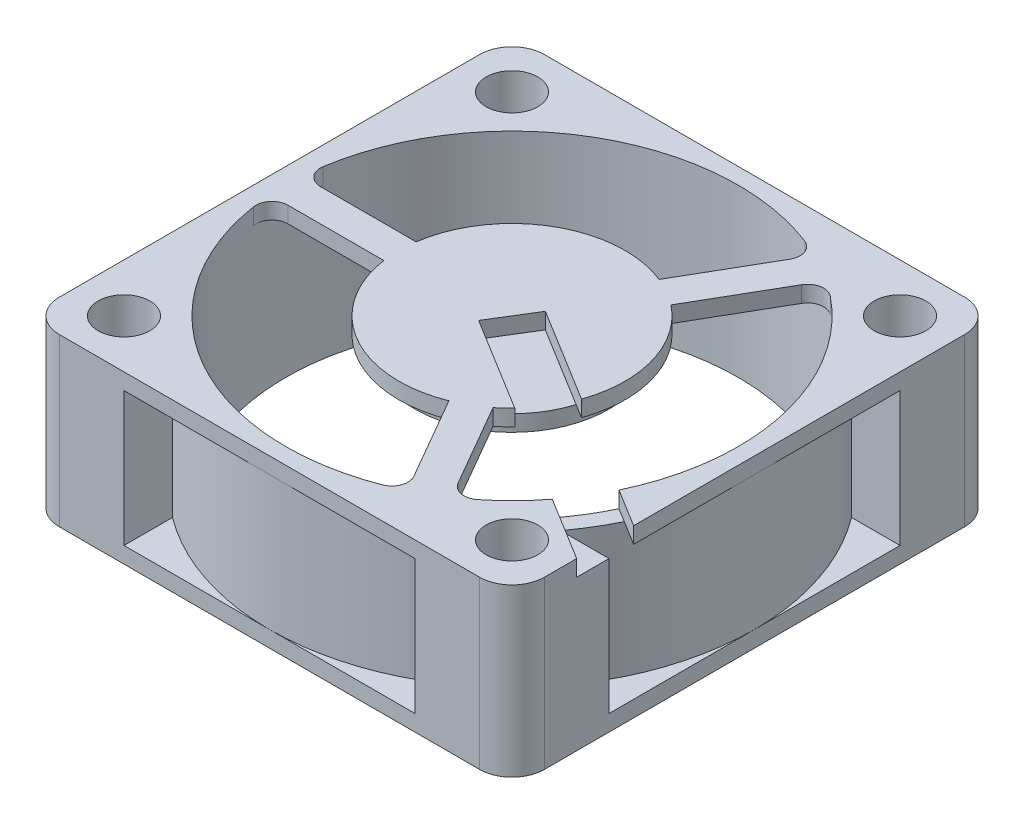
from build123d import *
from build123d.topology import SkipClean

# Parameters (mm, degrees)
CROQUIS2_R               = 1.6
CROQUIS2_R_2             = 14
SALIENTE_EXTRUIR1_DEPTH  = 1
SALIENTE_EXTRUIR2_START  = -10.3
CROQUIS3_R               = 15
CROQUIS3_R_2             = 14
SALIENTE_EXTRUIR2_DEPTH  = 10.3
SALIENTE_EXTRUIR4_START  = -1
SALIENTE_EXTRUIR4_DEPTH  = 1
REDONDEO2_R              = 1
REDONDEO3_R              = 2
CROQUIS11_R              = 1.6
SALIENTE_EXTRUIR9_DEPTH  = 1
SALIENTE_EXTRUIR10_START = 8.3
CROQUIS12_R              = 1.6
SALIENTE_EXTRUIR10_DEPTH = 8.3
CROQUIS13_R              = 6
SALIENTE_EXTRUIR11_DEPTH = 1
CORTAR_EXTRUIR1_DEPTH    = 1


with BuildPart() as part:
    # Croquis2 → Saliente-Extruir1 (new body)
    with BuildSketch(Plane(origin=(0, 0, 0), x_dir=(1, 0, 0), z_dir=(0, 1, 0))):
        Polygon((-15, 15), (-15, -15), (15, -15), (15, 9.614285714), (15, 15), align=None)
        with BuildLine():
            ThreePointArc((-14, -13.979950525), (-13.990000513, -13.990000513), (-13.979950525, -14))
            Line((-13.979950525, -14), (-14, -14))
            Line((-14, -14), (-14, -13.979950525))
        make_face(mode=Mode.SUBTRACT)
        with Locations(Location((-12, -12, 0), (0, 0, 270))):
            Circle(CROQUIS2_R, mode=Mode.SUBTRACT)
        with BuildLine():
            Line((14, -14), (13.979950525, -14))
            ThreePointArc((13.979950525, -14), (13.990000513, -13.990000513), (14, -13.979950525))
            Line((14, -13.979950525), (14, -14))
        make_face(mode=Mode.SUBTRACT)
        with Locations(Location((12, -12, 0), (0, 0, 270))):
            Circle(CROQUIS2_R, mode=Mode.SUBTRACT)
        with Locations(Location((-12, 12, 0), (0, 0, 270))):
            Circle(CROQUIS2_R, mode=Mode.SUBTRACT)
        with BuildLine():
            ThreePointArc((-13.979950525, 14), (-13.990000513, 13.990000513), (-14, 13.979950525))
            Line((-14, 13.979950525), (-14, 14))
            Line((-14, 14), (-13.979950525, 14))
        make_face(mode=Mode.SUBTRACT)
        with Locations(Location((0, 0, 0), (0, 0, 270))):
            Circle(CROQUIS2_R_2, mode=Mode.SUBTRACT)
        with Locations(Location((12, 12, 0), (0, 0, 270))):
            Circle(CROQUIS2_R, mode=Mode.SUBTRACT)
    extrude(amount=SALIENTE_EXTRUIR1_DEPTH)

    # Croquis3 → Saliente-Extruir2 (add)
    with BuildSketch(Plane(origin=(0, 1, 0), x_dir=(1, 0, 0), z_dir=(0, 1, 0)).offset(SALIENTE_EXTRUIR2_START)):
        with Locations(Location((0, 0, 0), (0, 0, 270))):
            Circle(CROQUIS3_R)
        with Locations(Location((0, 0, 0), (0, 0, 270))):
            Circle(CROQUIS3_R_2, mode=Mode.SUBTRACT)
    extrude(amount=SALIENTE_EXTRUIR2_DEPTH)

    # Croquis5 → Saliente-Extruir4 (add)
    with BuildSketch(Plane(origin=(0, 1, 0), x_dir=(1, 0, 0), z_dir=(0, 1, 0)).offset(SALIENTE_EXTRUIR4_START)):
        with BuildLine():
            ThreePointArc((-13.964240044, 1), (-14, 0), (-13.964240044, -1))
            Line((-13.964240044, -1), (-6.92820323, -1))
            ThreePointArc((-6.92820323, -1), (-7, 0), (-6.92820323, 1))
            Line((-6.92820323, 1), (-13.964240044, 1))
        make_face()
        with BuildLine():
            ThreePointArc((-6.92820323, 1), (-7, 0), (-6.92820323, -1))
            Line((-6.92820323, -1), (-1.732050808, -1))
            Line((-1.732050808, -1), (-1.154700538, 0))
            Line((-1.154700538, 0), (-1.732050808, 1))
            Line((-1.732050808, 1), (-6.92820323, 1))
        make_face()
        with BuildLine():
            ThreePointArc((-4.330127019, 5.5), (-6.062177826, 3.5), (-6.92820323, 1))
            Line((-6.92820323, 1), (-1.732050808, 1))
            Line((-1.732050808, 1), (-4.330127019, 5.5))
        make_face()
        with BuildLine():
            Line((-4.330127019, 5.5), (-1.732050808, 1))
            Line((-1.732050808, 1), (-0.577350269, 1))
            Line((-0.577350269, 1), (0, 2))
            Line((0, 2), (-2.598076211, 6.5))
            ThreePointArc((-2.598076211, 6.5), (-3.5, 6.062177826), (-4.330127019, 5.5))
        make_face()
        with BuildLine():
            ThreePointArc((2.598076211, 6.5), (0, 7), (-2.598076211, 6.5))
            Line((-2.598076211, 6.5), (0, 2))
            Line((0, 2), (2.598076211, 6.5))
        make_face()
        with BuildLine():
            Line((4.330127019, 5.5), (1.732050808, 1))
            Line((1.732050808, 1), (6.92820323, 1))
            ThreePointArc((6.92820323, 1), (6.062177826, 3.5), (4.330127019, 5.5))
        make_face()
        with BuildLine():
            Line((0, 2), (0.577350269, 1))
            Line((0.577350269, 1), (1.732050808, 1))
            Line((1.732050808, 1), (4.330127019, 5.5))
            ThreePointArc((4.330127019, 5.5), (3.5, 6.062177826), (2.598076211, 6.5))
            Line((2.598076211, 6.5), (0, 2))
        make_face()
        with BuildLine():
            Line((1.154700538, 0), (1.732050808, -1))
            Line((1.732050808, -1), (6.92820323, -1))
            ThreePointArc((6.92820323, -1), (6.982027736, -0.501287038), (7, 0))
            ThreePointArc((7, 0), (6.982027736, 0.501287038), (6.92820323, 1))
            Line((6.92820323, 1), (1.732050808, 1))
            Line((1.732050808, 1), (1.154700538, 0))
        make_face()
        with BuildLine():
            Line((6.92820323, -1), (1.732050808, -1))
            Line((1.732050808, -1), (4.330127019, -5.5))
            ThreePointArc((4.330127019, -5.5), (6.062177826, -3.5), (6.92820323, -1))
        make_face()
        with BuildLine():
            Line((1.732050808, -1), (0.577350269, -1))
            Line((0.577350269, -1), (0, -2))
            Line((0, -2), (2.598076211, -6.5))
            ThreePointArc((2.598076211, -6.5), (3.5, -6.062177826), (4.330127019, -5.5))
            Line((4.330127019, -5.5), (1.732050808, -1))
        make_face()
        with BuildLine():
            Line((0, -2), (-2.598076211, -6.5))
            ThreePointArc((-2.598076211, -6.5), (0, -7), (2.598076211, -6.5))
            Line((2.598076211, -6.5), (0, -2))
        make_face()
        with BuildLine():
            Line((-0.577350269, -1), (-1.732050808, -1))
            Line((-1.732050808, -1), (-4.330127019, -5.5))
            ThreePointArc((-4.330127019, -5.5), (-3.5, -6.062177826), (-2.598076211, -6.5))
            Line((-2.598076211, -6.5), (0, -2))
            Line((0, -2), (-0.577350269, -1))
        make_face()
        with BuildLine():
            Line((-1.732050808, -1), (-6.92820323, -1))
            ThreePointArc((-6.92820323, -1), (-6.062177826, -3.5), (-4.330127019, -5.5))
            Line((-4.330127019, -5.5), (-1.732050808, -1))
        make_face()
        Polygon((-1.154700538, 0), (-0.577350269, -1), (0.577350269, -1), (1.154700538, 0), (0.577350269, 1), (-0.577350269, 1), align=None)
        Polygon((-1.732050808, 1), (-1.154700538, 0), (-0.577350269, 1), align=None)
        Polygon((-1.154700538, 0), (-1.732050808, -1), (-0.577350269, -1), align=None)
        Polygon((0.577350269, -1), (-0.577350269, -1), (0, -2), align=None)
        Polygon((1.154700538, 0), (0.577350269, -1), (1.732050808, -1), align=None)
        Polygon((0.577350269, 1), (1.154700538, 0), (1.732050808, 1), align=None)
        Polygon((0, 2), (-0.577350269, 1), (0.577350269, 1), align=None)
        with BuildLine():
            ThreePointArc((7.848145426, 11.593386622), (7, 12.124355653), (6.116094618, 12.593386622))
            Line((6.116094618, 12.593386622), (2.598076211, 6.5))
            ThreePointArc((2.598076211, 6.5), (3.5, 6.062177826), (4.330127019, 5.5))
            Line((4.330127019, 5.5), (7.848145426, 11.593386622))
        make_face()
        with BuildLine():
            Line((2.598076211, -6.5), (6.116094618, -12.593386622))
            ThreePointArc((6.116094618, -12.593386622), (7, -12.124355653), (7.848145426, -11.593386622))
            Line((7.848145426, -11.593386622), (4.330127019, -5.5))
            ThreePointArc((4.330127019, -5.5), (3.5, -6.062177826), (2.598076211, -6.5))
        make_face()
    extrude(amount=SALIENTE_EXTRUIR4_DEPTH)

    # Redondeo2
    redondeo2_edges = [part.edges().sort_by_distance(p)[0] for p in [
        (-13.964240044, 0.5, 1),
        (-13.964240044, 0.5, -1),
        (6.116094618, 0.5, -12.593386622),
        (7.848145426, 0.5, -11.593386622),
        (7.848145426, 0.5, 11.593386622),
        (6.116094618, 0.5, 12.593386622),
    ]]
    fillet(redondeo2_edges, radius=REDONDEO2_R)

    # Redondeo3
    redondeo3_edges = [part.edges().sort_by_distance(p)[0] for p in [
        (-15, 0.5, 15),
        (-15, 0.5, -15),
        (15, 0.5, -15),
        (15, 0.5, 15),
    ]]
    fillet(redondeo3_edges, radius=REDONDEO3_R)

    # Croquis11 → Saliente-Extruir9 (add)
    # profile 1 of 4: a face of its own
    with BuildSketch(Plane.XZ.offset(9.3)):
        with BuildLine():
            ThreePointArc((-15, 0), (-10.606601718, 10.606601718), (0, 15))
            Line((0, 15), (-13, 15))
            ThreePointArc((-13, 15), (-14.414213562, 14.414213562), (-15, 13))
            Line((-15, 13), (-15, 0))
        make_face()
        with Locations(Location((-12, 12, 0), (0, 0, 90))):
            Circle(CROQUIS11_R, mode=Mode.SUBTRACT)
    # profile 2 of 4: a face of its own
    with BuildSketch(Plane.XZ.offset(9.3)):
        with BuildLine():
            ThreePointArc((0, 15), (10.606601718, 10.606601718), (15, 0))
            Line((15, 0), (15, 13))
            ThreePointArc((15, 13), (14.414213562, 14.414213562), (13, 15))
            Line((13, 15), (0, 15))
        make_face()
        with Locations(Location((12, 12, 0), (0, 0, 90))):
            Circle(CROQUIS11_R, mode=Mode.SUBTRACT)
    # profile 3 of 4: a face of its own
    with BuildSketch(Plane.XZ.offset(9.3)):
        with BuildLine():
            Line((15, -13), (15, 0))
            ThreePointArc((15, 0), (10.606601718, -10.606601718), (0, -15))
            Line((0, -15), (13, -15))
            ThreePointArc((13, -15), (14.414213562, -14.414213562), (15, -13))
        make_face()
        with Locations(Location((12, -12, 0), (0, 0, 90))):
            Circle(CROQUIS11_R, mode=Mode.SUBTRACT)
    # profile 4 of 4: a face of its own
    with BuildSketch(Plane.XZ.offset(9.3)):
        with BuildLine():
            Line((-13, -15), (0, -15))
            ThreePointArc((0, -15), (-10.606601718, -10.606601718), (-15, 0))
            Line((-15, 0), (-15, -13))
            ThreePointArc((-15, -13), (-14.414213562, -14.414213562), (-13, -15))
        make_face()
        with Locations(Location((-12, -12, 0), (0, 0, 90))):
            Circle(CROQUIS11_R, mode=Mode.SUBTRACT)
    extrude(amount=-SALIENTE_EXTRUIR9_DEPTH)

    # Croquis12 → Saliente-Extruir10 (add)
    # profile 1 of 25: a face of its own
    with SkipClean():  # the faces are left unmerged after this step: merging them gives an invalid solid
        with BuildSketch(Plane.XZ.offset(SALIENTE_EXTRUIR10_START)):
            with BuildLine():
                ThreePointArc((-9, -12), (-9.878679656, -14.121320344), (-12, -15))
                Line((-12, -15), (-9, -15))
                Line((-9, -15), (-9, -12))
            make_face()
        # profile 2 of 25: a face of its own
        with BuildSketch(Plane.XZ.offset(SALIENTE_EXTRUIR10_START)):
            with BuildLine():
                ThreePointArc((-10.165059333, -9.626607334), (-11.030509928, -9.160970412), (-12, -9))
                ThreePointArc((-12, -9), (-10.606601718, -10.606601718), (-9, -12))
                ThreePointArc((-9, -12), (-9.160970412, -11.030509928), (-9.626607334, -10.165059333))
                ThreePointArc((-9.626607334, -10.165059333), (-9.899494937, -9.899494937), (-10.165059333, -9.626607334))
            make_face()
        # profile 3 of 25: a face of its own
        with BuildSketch(Plane.XZ.offset(SALIENTE_EXTRUIR10_START)):
            with BuildLine():
                Line((9, -15), (11.999999991, -15))
                ThreePointArc((11.999999991, -15), (9.878679653, -14.12132034), (9, -12))
                Line((9, -12), (9, -15))
            make_face()
        # profile 4 of 25: a face of its own
        with BuildSketch(Plane.XZ.offset(SALIENTE_EXTRUIR10_START)):
            with BuildLine():
                Line((15, -13), (15, -12))
                ThreePointArc((15, -12), (14.12132034, -14.121320347), (11.999999991, -15))
                Line((11.999999991, -15), (13, -15))
                ThreePointArc((13, -15), (14.414213562, -14.414213562), (15, -13))
            make_face()
        # profile 5 of 25: a face of its own
        with BuildSketch(Plane.XZ.offset(SALIENTE_EXTRUIR10_START)):
            with BuildLine():
                Line((15, -9), (12, -9))
                ThreePointArc((12, -9), (14.121320344, -9.878679656), (15, -12))
                Line((15, -12), (15, -9))
            make_face()
        # profile 6 of 25: a face of its own
        with BuildSketch(Plane.XZ.offset(SALIENTE_EXTRUIR10_START)):
            with BuildLine():
                ThreePointArc((15, -12), (14.121320344, -9.878679656), (12, -9))
                ThreePointArc((12, -9), (11.030509928, -9.160970412), (10.165059333, -9.626607334))
                ThreePointArc((10.165059333, -9.626607334), (9.899494937, -9.899494937), (9.626607334, -10.165059333))
                ThreePointArc((9.626607334, -10.165059333), (9.160970412, -11.030509928), (9, -12))
                ThreePointArc((9, -12), (9.878679653, -14.12132034), (11.999999991, -15))
                ThreePointArc((11.999999991, -15), (14.12132034, -14.121320347), (15, -12))
            make_face()
            with Locations(Location((12, -12, 0), (0, 0, 270))):
                Circle(CROQUIS12_R, mode=Mode.SUBTRACT)
        # profile 7 of 25: a face of its own
        with BuildSketch(Plane.XZ.offset(SALIENTE_EXTRUIR10_START)):
            with BuildLine():
                ThreePointArc((9, -12), (9.160970412, -11.030509928), (9.626607334, -10.165059333))
                ThreePointArc((9.626607334, -10.165059333), (9.317492927, -10.449130373), (9, -10.723805295))
                Line((9, -10.723805295), (9, -12))
            make_face()
        # profile 8 of 25: a face of its own
        with BuildSketch(Plane.XZ.offset(SALIENTE_EXTRUIR10_START)):
            with BuildLine():
                ThreePointArc((10.165059333, -9.626607334), (11.030509928, -9.160970412), (12, -9))
                Line((12, -9), (10.723805295, -9))
                ThreePointArc((10.723805295, -9), (10.449130373, -9.317492927), (10.165059333, -9.626607334))
            make_face()
        # profile 9 of 25: a face of its own
        with BuildSketch(Plane.XZ.offset(SALIENTE_EXTRUIR10_START)):
            with BuildLine():
                ThreePointArc((-10.165059333, 9.626607334), (-11.030509928, 9.160970412), (-12, 9))
                Line((-12, 9), (-10.723805295, 9))
                ThreePointArc((-10.723805295, 9), (-10.449130373, 9.317492927), (-10.165059333, 9.626607334))
            make_face()
        # profile 10 of 25: a face of its own
        with BuildSketch(Plane.XZ.offset(SALIENTE_EXTRUIR10_START)):
            with BuildLine():
                ThreePointArc((-9, 12), (-9.160970412, 11.030509928), (-9.626607334, 10.165059333))
                ThreePointArc((-9.626607334, 10.165059333), (-9.317492927, 10.449130373), (-9, 10.723805295))
                Line((-9, 10.723805295), (-9, 12))
            make_face()
        # profile 11 of 25: a face of its own
        with BuildSketch(Plane.XZ.offset(SALIENTE_EXTRUIR10_START)):
            with BuildLine():
                ThreePointArc((-15, 12), (-14.121320344, 9.878679656), (-12, 9))
                ThreePointArc((-12, 9), (-11.030509928, 9.160970412), (-10.165059333, 9.626607334))
                ThreePointArc((-10.165059333, 9.626607334), (-9.899494937, 9.899494937), (-9.626607334, 10.165059333))
                ThreePointArc((-9.626607334, 10.165059333), (-9.160970412, 11.030509928), (-9, 12))
                ThreePointArc((-9, 12), (-9.878679643, 14.12132033), (-11.999999962, 15))
                ThreePointArc((-11.999999962, 15), (-14.12132033, 14.121320357), (-15, 12))
            make_face()
            with Locations(Location((-12, 12, 0), (0, 0, 270))):
                Circle(CROQUIS12_R, mode=Mode.SUBTRACT)
        # profile 12 of 25: a face of its own
        with BuildSketch(Plane.XZ.offset(SALIENTE_EXTRUIR10_START)):
            with BuildLine():
                Line((-15, 9), (-12, 9))
                ThreePointArc((-12, 9), (-14.121320344, 9.878679656), (-15, 12))
                Line((-15, 12), (-15, 9))
            make_face()
        # profile 13 of 25: a face of its own
        with BuildSketch(Plane.XZ.offset(SALIENTE_EXTRUIR10_START)):
            with BuildLine():
                Line((-15, 13), (-15, 12))
                ThreePointArc((-15, 12), (-14.12132033, 14.121320357), (-11.999999962, 15))
                Line((-11.999999962, 15), (-13, 15))
                ThreePointArc((-13, 15), (-14.414213562, 14.414213562), (-15, 13))
            make_face()
        # profile 14 of 25: a face of its own
        with BuildSketch(Plane.XZ.offset(SALIENTE_EXTRUIR10_START)):
            with BuildLine():
                Line((-9, 15), (-11.999999962, 15))
                ThreePointArc((-11.999999962, 15), (-9.878679643, 14.12132033), (-9, 12))
                Line((-9, 12), (-9, 15))
            make_face()
        # profile 15 of 25: a face of its own
        with BuildSketch(Plane.XZ.offset(SALIENTE_EXTRUIR10_START)):
            with BuildLine():
                Line((10.723805295, 9), (12, 9))
                ThreePointArc((12, 9), (11.030509928, 9.160970412), (10.165059333, 9.626607334))
                ThreePointArc((10.165059333, 9.626607334), (10.449130373, 9.317492927), (10.723805295, 9))
            make_face()
        # profile 16 of 25: a face of its own
        with BuildSketch(Plane.XZ.offset(SALIENTE_EXTRUIR10_START)):
            with BuildLine():
                ThreePointArc((9.626607334, 10.165059333), (9.160970412, 11.030509928), (9, 12))
                Line((9, 12), (9, 10.723805295))
                ThreePointArc((9, 10.723805295), (9.317492927, 10.449130373), (9.626607334, 10.165059333))
            make_face()
        # profile 17 of 25: a face of its own
        with BuildSketch(Plane.XZ.offset(SALIENTE_EXTRUIR10_START)):
            with BuildLine():
                ThreePointArc((12, 9), (14.121320344, 9.878679656), (15, 12))
                ThreePointArc((15, 12), (14.121320352, 14.121320335), (12.000000024, 15))
                ThreePointArc((12.000000024, 15), (9.878679665, 14.121320352), (9, 12))
                ThreePointArc((9, 12), (9.160970412, 11.030509928), (9.626607334, 10.165059333))
                ThreePointArc((9.626607334, 10.165059333), (9.899494937, 9.899494937), (10.165059333, 9.626607334))
                ThreePointArc((10.165059333, 9.626607334), (11.030509928, 9.160970412), (12, 9))
            make_face()
            with Locations(Location((12, 12, 0), (0, 0, 270))):
                Circle(CROQUIS12_R, mode=Mode.SUBTRACT)
        # profile 18 of 25: a face of its own
        with BuildSketch(Plane.XZ.offset(SALIENTE_EXTRUIR10_START)):
            with BuildLine():
                ThreePointArc((12.000000024, 15), (14.121320352, 14.121320335), (15, 12))
                Line((15, 12), (15, 13))
                ThreePointArc((15, 13), (14.414213562, 14.414213562), (13, 15))
                Line((13, 15), (12.000000024, 15))
            make_face()
        # profile 19 of 25: a face of its own
        with BuildSketch(Plane.XZ.offset(SALIENTE_EXTRUIR10_START)):
            with BuildLine():
                Line((12, 9), (15, 9))
                Line((15, 9), (15, 12))
                ThreePointArc((15, 12), (14.121320344, 9.878679656), (12, 9))
            make_face()
        # profile 20 of 25: a face of its own
        with BuildSketch(Plane.XZ.offset(SALIENTE_EXTRUIR10_START)):
            with BuildLine():
                ThreePointArc((9, 12), (9.878679665, 14.121320352), (12.000000024, 15))
                Line((12.000000024, 15), (9, 15))
                Line((9, 15), (9, 12))
            make_face()
        # profile 21 of 25: a face of its own
        with BuildSketch(Plane.XZ.offset(SALIENTE_EXTRUIR10_START)):
            with BuildLine():
                ThreePointArc((-12, -9), (-14.121320344, -9.878679656), (-15, -12))
                ThreePointArc((-15, -12), (-14.121320344, -14.121320344), (-12, -15))
                ThreePointArc((-12, -15), (-9.878679656, -14.121320344), (-9, -12))
                ThreePointArc((-9, -12), (-10.606601718, -10.606601718), (-12, -9))
            make_face()
            with BuildLine():
                Line((-14, -14), (-14, -13.979950525))
                ThreePointArc((-14, -13.979950525), (-13.990000513, -13.990000513), (-13.979950525, -14))
                Line((-13.979950525, -14), (-14, -14))
            make_face(mode=Mode.SUBTRACT)
            with Locations(Location((-12, -12, 0), (0, 0, 270))):
                Circle(CROQUIS12_R, mode=Mode.SUBTRACT)
        # profile 22 of 25: a face of its own
        with BuildSketch(Plane.XZ.offset(SALIENTE_EXTRUIR10_START)):
            with BuildLine():
                Line((-12, -9), (-15, -9))
                Line((-15, -9), (-15, -12))
                ThreePointArc((-15, -12), (-14.121320344, -9.878679656), (-12, -9))
            make_face()
        # profile 23 of 25: a face of its own
        with BuildSketch(Plane.XZ.offset(SALIENTE_EXTRUIR10_START)):
            with BuildLine():
                ThreePointArc((-12, -15), (-14.121320344, -14.121320344), (-15, -12))
                Line((-15, -12), (-15, -13))
                ThreePointArc((-15, -13), (-14.414213562, -14.414213562), (-13, -15))
                Line((-13, -15), (-12, -15))
            make_face()
        # profile 24 of 25: a face of its own
        with BuildSketch(Plane.XZ.offset(SALIENTE_EXTRUIR10_START)):
            with BuildLine():
                Line((-10.723805295, -9), (-12, -9))
                ThreePointArc((-12, -9), (-11.030509928, -9.160970412), (-10.165059333, -9.626607334))
                ThreePointArc((-10.165059333, -9.626607334), (-10.449130373, -9.317492927), (-10.723805295, -9))
            make_face()
        # profile 25 of 25: a face of its own
        with BuildSketch(Plane.XZ.offset(SALIENTE_EXTRUIR10_START)):
            with BuildLine():
                ThreePointArc((-9.626607334, -10.165059333), (-9.160970412, -11.030509928), (-9, -12))
                Line((-9, -12), (-9, -10.723805295))
                ThreePointArc((-9, -10.723805295), (-9.317492927, -10.449130373), (-9.626607334, -10.165059333))
            make_face()
        extrude(amount=-SALIENTE_EXTRUIR10_DEPTH)

    # Croquis13 → Saliente-Extruir11 (add)
    with SkipClean():  # the faces are left unmerged after this step: merging them gives an invalid solid
        with BuildSketch(Plane.XZ):
            with Locations(Location((0, 0, 0), (0, 0, 90))):
                Circle(CROQUIS13_R)
        extrude(amount=SALIENTE_EXTRUIR11_DEPTH)

    # Croquis14 → Cortar-Extruir1 (cut)
    with SkipClean():  # the faces are left unmerged after this step: merging them gives an invalid solid
        with BuildSketch(Plane(origin=(0, 1, 0), x_dir=(1, 0, 0), z_dir=(0, 1, 0))):
            Polygon((15, -11), (-0.786613259, -1.277199899), (0.786613259, 1.277199899), (16.573226518, -8.445600203), align=None)
        extrude(amount=-CORTAR_EXTRUIR1_DEPTH, mode=Mode.SUBTRACT)


solid = part.part
